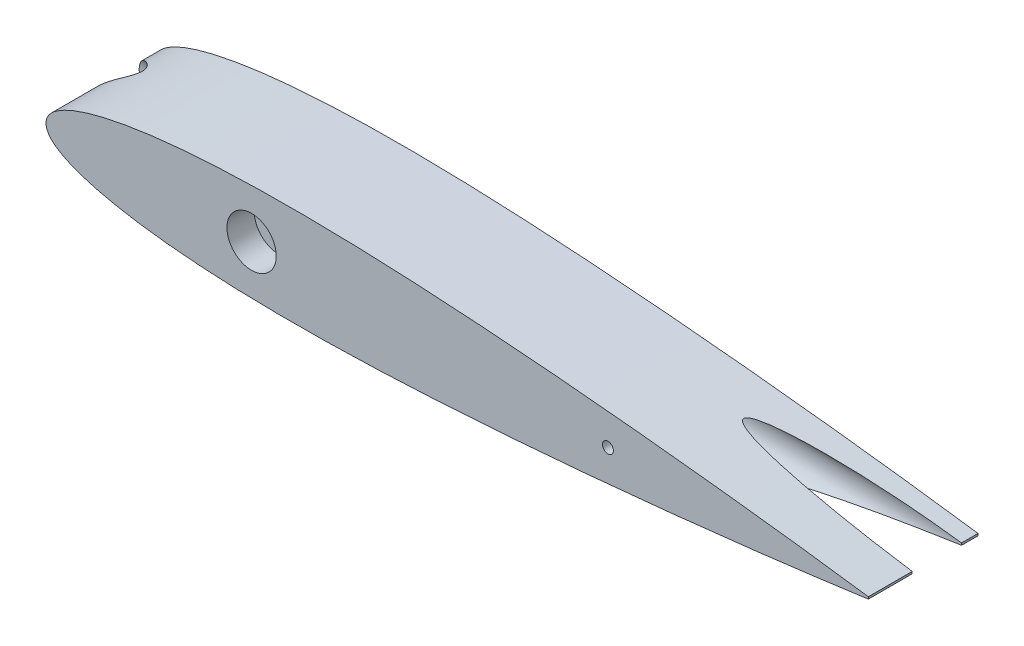
from build123d import *

# Parameters (mm, degrees)
BOSS_EXTRUDE1_DEPTH     = 40
CUT_EXTRUDE6_DEPTH      = 304.189921619
CUT_EXTRUDE6_DEPTH_BACK = 304.189921619
SKETCH6_R               = 9
SKETCH7_R               = 9
SKETCH7_R_2             = 2
CUT_EXTRUDE7_DEPTH      = 10


with BuildPart() as part:
    # Sketch5 → Boss-Extrude1 (new body)
    with BuildSketch(Plane.XY):
        with BuildLine():
            Line((300, 0.378), (300, -0.378))
            add(Edge.make_bspline(
                [(300, 0.378), (299.270406424, 0.479445822), (297.234667094, 0.762503754), (293.659650161, 1.257673506), (289.112411795, 1.874242443), (284.080816659, 2.54451744), (278.752044218, 3.238122316), (273.265899022, 3.934946436), (267.705955472, 4.629019943), (262.11456302, 5.313069107), (256.508348909, 5.982191812), (250.891738994, 6.637990809), (245.269556965, 7.281779235), (239.647345349, 7.912232764), (234.025130107, 8.526992046), (228.399087903, 9.126229764), (222.768257645, 9.713077606), (217.135920793, 10.28745981), (211.505410154, 10.846941084), (205.877619803, 11.391642827), (200.251512374, 11.920884624), (194.626420536, 12.434617078), (189.002797137, 12.931911809), (183.381530938, 13.413097581), (177.763225616, 13.876376701), (172.148301533, 14.321237194), (166.537529462, 14.747820918), (160.931736194, 15.154228144), (155.33170885, 15.539100856), (149.737538345, 15.902649564), (144.148688279, 16.241846119), (138.565679604, 16.557420546), (132.990859803, 16.847397555), (127.42743944, 17.110211679), (121.877619637, 17.343891718), (116.340758577, 17.545256813), (110.815476382, 17.71267912), (105.301273398, 17.844497938), (99.800570116, 17.940091813), (94.317435844, 17.996590439), (88.855764067, 18.010124458), (83.418647975, 17.97923384), (78.008480827, 17.899160713), (72.628455365, 17.767033787), (67.282738746, 17.579413934), (61.977364895, 17.331515489), (56.720691016, 17.021032651), (51.525175322, 16.64095807), (46.408202619, 16.190188591), (41.394176065, 15.661669099), (36.515671087, 15.053963784), (31.819009441, 14.365623605), (27.366164829, 13.603475684), (23.235217954, 12.782583444), (19.502642451, 11.920250751), (16.218271393, 11.044597796), (13.389186016, 10.175076255), (10.984929333, 9.333498715), (8.961561478, 8.522062882), (7.267292053, 7.746976002), (5.846052466, 7.010625622), (4.647711085, 6.300634033), (3.628235251, 5.606513668), (2.751909197, 4.926635252), (2.00625736, 4.249917259), (1.390586137, 3.570259492), (0.901000435, 2.890942252), (0.529275535, 2.220219273), (0.260479537, 1.566458936), (0.085712654, 0.931035928), (-0.003509247, 0.308981015), (-0.003509247, -0.308981015), (0.085712654, -0.931035928), (0.260479537, -1.566458936), (0.529275535, -2.220219273), (0.901000435, -2.890942252), (1.390586137, -3.570259492), (2.00625736, -4.249917259), (2.751909197, -4.926635252), (3.628235251, -5.606513668), (4.647711085, -6.300634033), (5.846052466, -7.010625622), (7.267292053, -7.746975999), (8.961561475, -8.522062895), (10.984929344, -9.333498651), (13.389185965, -10.175076559), (16.21827163, -11.044596377), (19.502641361, -11.92025728), (23.235222799, -12.782554413), (27.366127559, -13.603596161), (31.819075008, -14.365113363), (36.515634637, -15.054106097), (41.394182204, -15.661628887), (46.408200924, -16.190199694), (51.525175786, -16.640955027), (56.720690889, -17.02103348), (61.977364929, -17.331515263), (67.282738736, -17.579413995), (72.628455367, -17.767033771), (78.008480826, -17.899160717), (83.418647975, -17.979233839), (88.855764067, -18.010124458), (94.317435844, -17.996590438), (99.800570116, -17.940091813), (105.301273398, -17.844497938), (110.815476382, -17.71267912), (116.340758577, -17.545256813), (121.877619637, -17.343891718), (127.42743944, -17.110211679), (132.990859803, -16.847397555), (138.565679604, -16.557420546), (144.148688279, -16.241846119), (149.737538345, -15.902649564), (155.33170885, -15.539100856), (160.931736194, -15.154228144), (166.537529462, -14.747820918), (172.148301533, -14.321237194), (177.763225616, -13.876376701), (183.381530938, -13.413097581), (189.002797137, -12.931911809), (194.626420536, -12.434617078), (200.251512374, -11.920884624), (205.877619803, -11.391642827), (211.505410154, -10.846941084), (217.135920793, -10.28745981), (222.768257645, -9.713077606), (228.399087903, -9.126229764), (234.025130107, -8.526992046), (239.647345349, -7.912232764), (245.269556965, -7.281779235), (250.891738994, -6.637990809), (256.508348909, -5.982191812), (262.11456302, -5.313069107), (267.705955472, -4.629019943), (273.265899022, -3.934946436), (278.752044218, -3.238122316), (284.080816659, -2.54451744), (289.112411795, -1.874242443), (293.659650161, -1.257673506), (297.234667094, -0.762503754), (299.270406424, -0.479445822), (300, -0.378)],
                knots=[0, 0, 0, 0, 0.003612221, 0.010078953, 0.017698618, 0.026115111, 0.034970966, 0.04405038, 0.05323433, 0.06244757, 0.071673993, 0.080921319, 0.090177538, 0.099424342, 0.108664441, 0.117912199, 0.127169502, 0.136426595, 0.145675426, 0.154916495, 0.164153237, 0.173386649, 0.182615736, 0.191838089, 0.201053134, 0.210260393, 0.219458942, 0.228646747, 0.237822316, 0.246985224, 0.256137384, 0.265279416, 0.27440695, 0.283512193, 0.292591781, 0.301646285, 0.310681793, 0.319699068, 0.32869452, 0.33766016, 0.346588583, 0.355477412, 0.364322937, 0.373121614, 0.381867635, 0.390553005, 0.399166026, 0.407689628, 0.416098119, 0.424354887, 0.432412429, 0.440204728, 0.447630505, 0.454563638, 0.460855379, 0.466413319, 0.47122861, 0.475365774, 0.47890126, 0.481915077, 0.484498872, 0.486747127, 0.488741252, 0.490543179, 0.492182104, 0.493672831, 0.495031908, 0.49627906, 0.497424737, 0.498490166, 0.499502758, 0.500497254, 0.501509846, 0.502575275, 0.503720952, 0.504968104, 0.506327181, 0.507817908, 0.509456832, 0.51125876, 0.513252884, 0.51550114, 0.518084934, 0.521098752, 0.524634237, 0.528771401, 0.533586692, 0.539144632, 0.545436374, 0.552369506, 0.5597952, 0.567587571, 0.575645113, 0.583901881, 0.592310372, 0.600833974, 0.609446995, 0.618132365, 0.626878386, 0.635677063, 0.644522588, 0.653411417, 0.66233984, 0.67130548, 0.680300932, 0.689318207, 0.698353715, 0.707408219, 0.716487807, 0.72559305, 0.734720584, 0.743862616, 0.753014776, 0.762177684, 0.771353253, 0.780541058, 0.789739607, 0.798946866, 0.808161911, 0.817384264, 0.826613351, 0.835846763, 0.845083505, 0.854324574, 0.863573405, 0.872830498, 0.882087801, 0.891335559, 0.900575658, 0.909822462, 0.919078681, 0.928326007, 0.93755243, 0.94676567, 0.95594962, 0.965029034, 0.973884889, 0.982301382, 0.989921047, 0.996387779, 1, 1, 1, 1], degree=3))
        make_face()
    extrude(amount=BOSS_EXTRUDE1_DEPTH)

    # Sketch6 → Cut-Extrude6 (cut, two sides: drawn at the far end of the back side and taken through both)
    with BuildSketch(Plane(origin=(0, 0, 0), x_dir=(0, 0, -1), z_dir=(1, 0, 0)).offset(-CUT_EXTRUDE6_DEPTH_BACK)):
        with Locations((-15, 0)):
            Circle(SKETCH6_R)
    extrude(amount=CUT_EXTRUDE6_DEPTH + CUT_EXTRUDE6_DEPTH_BACK, mode=Mode.SUBTRACT)

    # Sketch7 → Cut-Extrude7 (cut)
    with BuildSketch(Plane.XY.offset(40)):
        with Locations((75, 0)):
            Circle(SKETCH7_R)
        with Locations((205, 0)):
            Circle(SKETCH7_R_2)
    extrude(amount=-CUT_EXTRUDE7_DEPTH, mode=Mode.SUBTRACT)


solid = part.part
